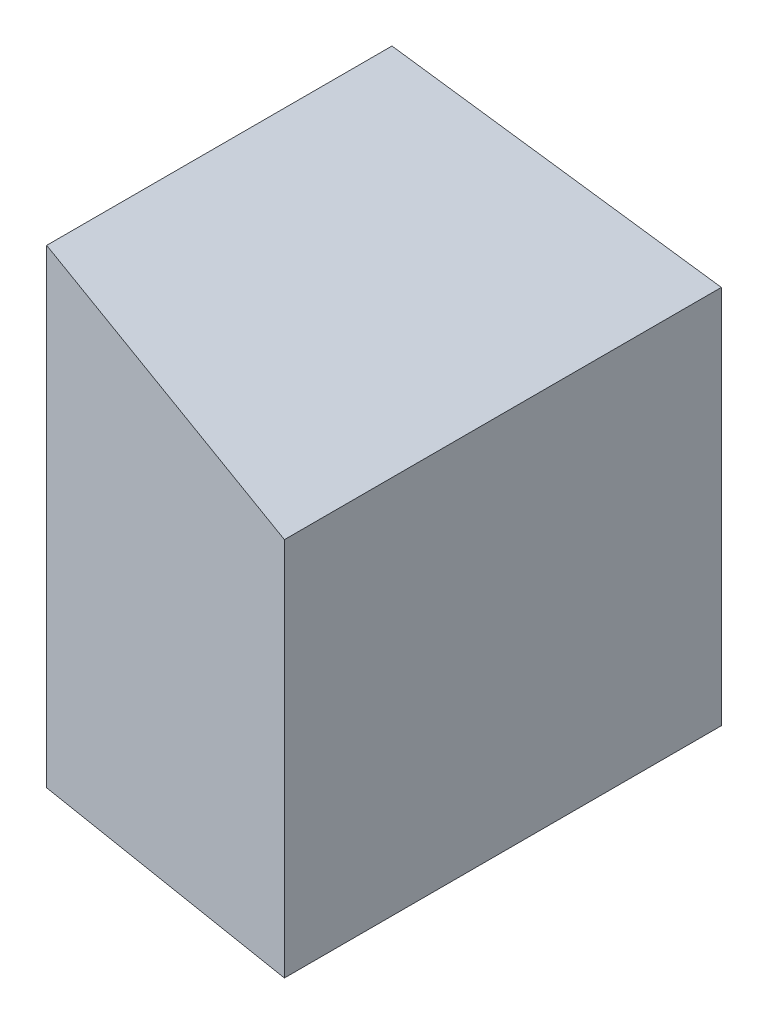
from build123d import *

# Parameters (mm, degrees)
BOSS_EXTRUDE1_DEPTH      = 1039.25
BOSS_EXTRUDE1_DEPTH_BACK = 1039.25
CUT_EXTRUDE1_DEPTH       = 4942.25


with BuildPart() as part:
    # Sketch1 → Boss-Extrude1 (new, two sides: drawn at the far end of the back side and taken through both)
    with BuildSketch(Plane.XY.offset(-BOSS_EXTRUDE1_DEPTH_BACK)):
        Polygon((0, 0), (1349, 0), (1349, 1806), (0, 2235), align=None)
    extrude(amount=BOSS_EXTRUDE1_DEPTH + BOSS_EXTRUDE1_DEPTH_BACK)

    # Sketch2 → Cut-Extrude1 (cut)
    with BuildSketch(Plane.XZ):
        Polygon((0, 821.33), (0, 1039.25), (1349, 1039.25), align=None)
        Polygon((0, -1039.25), (1349, -1039.25), (0, -821.33), align=None)
    extrude(amount=-CUT_EXTRUDE1_DEPTH, mode=Mode.SUBTRACT)


solid = part.part
